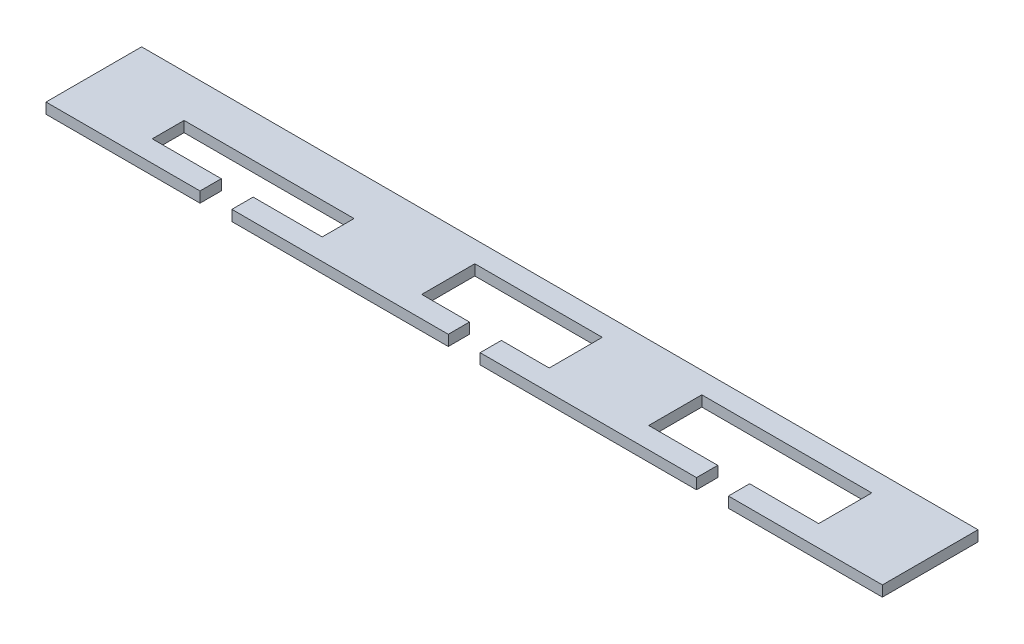
from build123d import *

# Parameters (mm, degrees)
BOSS_EXTRUDE1_DEPTH = 12.7


with BuildPart() as part:
    # Sketch1 → Boss-Extrude1 (new body)
    with BuildSketch(Plane(origin=(0, 0, 0), x_dir=(1, 0, 0), z_dir=(0, 1, 0))):
        Polygon((0, 0), (0, 114.3), (1000.00054, 114.3), (1000.00054, 0), (815.85054, 0), (815.85054, 25.4), (898.40054, 25.4), (898.40054, 88.9), (695.20054, 88.9), (695.20054, 25.4), (777.75054, 25.4), (777.75054, 0), (550.80027, 0), (519.05027, 0), (519.05027, 25.4), (576.20027, 25.4), (576.20027, 88.9), (423.80027, 88.9), (423.80027, 25.4), (480.95027, 25.4), (480.95027, 0), (449.20027, 0), (222.25, 0), (222.25, 25.4), (304.8, 25.4), (304.8, 63.5), (101.6, 63.5), (101.6, 25.4), (184.15, 25.4), (184.15, 0), align=None)
    extrude(amount=BOSS_EXTRUDE1_DEPTH)


solid = part.part
